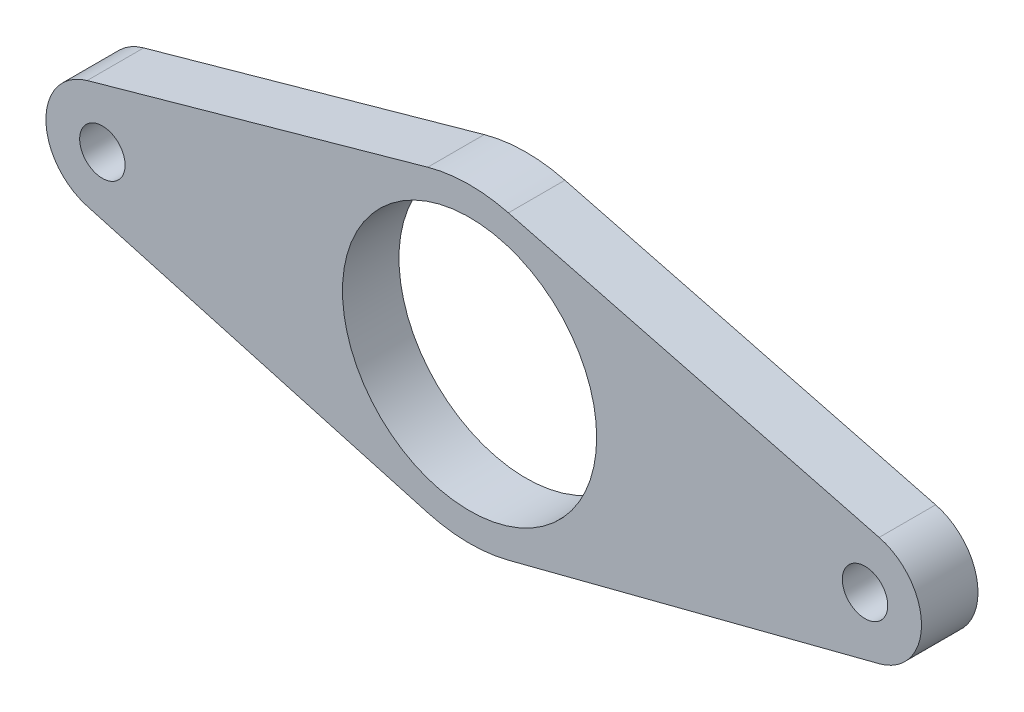
from build123d import *

# Parameters (mm, degrees)
SKETCH1_R           = 2.5527
SKETCH1_R_2         = 14.2875
BOSS_EXTRUDE1_DEPTH = 6.35


with BuildPart() as part:
    # Sketch1 → Boss-Extrude1 (new body)
    with BuildSketch(Plane.XY):
        with BuildLine():
            Line((-4.701442308, 16.817709311), (-42.984615385, 6.115530659))
            ThreePointArc((-42.984615385, 6.115530659), (-47.625, 0), (-42.984615385, -6.115530659))
            Line((-42.984615385, -6.115530659), (-4.701442308, -16.817709311))
            ThreePointArc((-4.701442308, -16.817709311), (-0.173870925, -17.461634378), (4.365625, -16.907992921))
            Line((4.365625, -16.907992921), (46.0375, -6.148361062))
            ThreePointArc((46.0375, -6.148361062), (50.8, 0), (46.0375, 6.148361062))
            Line((46.0375, 6.148361062), (4.365625, 16.907992921))
            ThreePointArc((4.365625, 16.907992921), (-0.173870925, 17.461634378), (-4.701442308, 16.817709311))
        make_face()
        with Locations((-41.275, 0)):
            Circle(SKETCH1_R, mode=Mode.SUBTRACT)
        Circle(SKETCH1_R_2, mode=Mode.SUBTRACT)
        with Locations((44.45, 0)):
            Circle(SKETCH1_R, mode=Mode.SUBTRACT)
    extrude(amount=BOSS_EXTRUDE1_DEPTH)


solid = part.part
